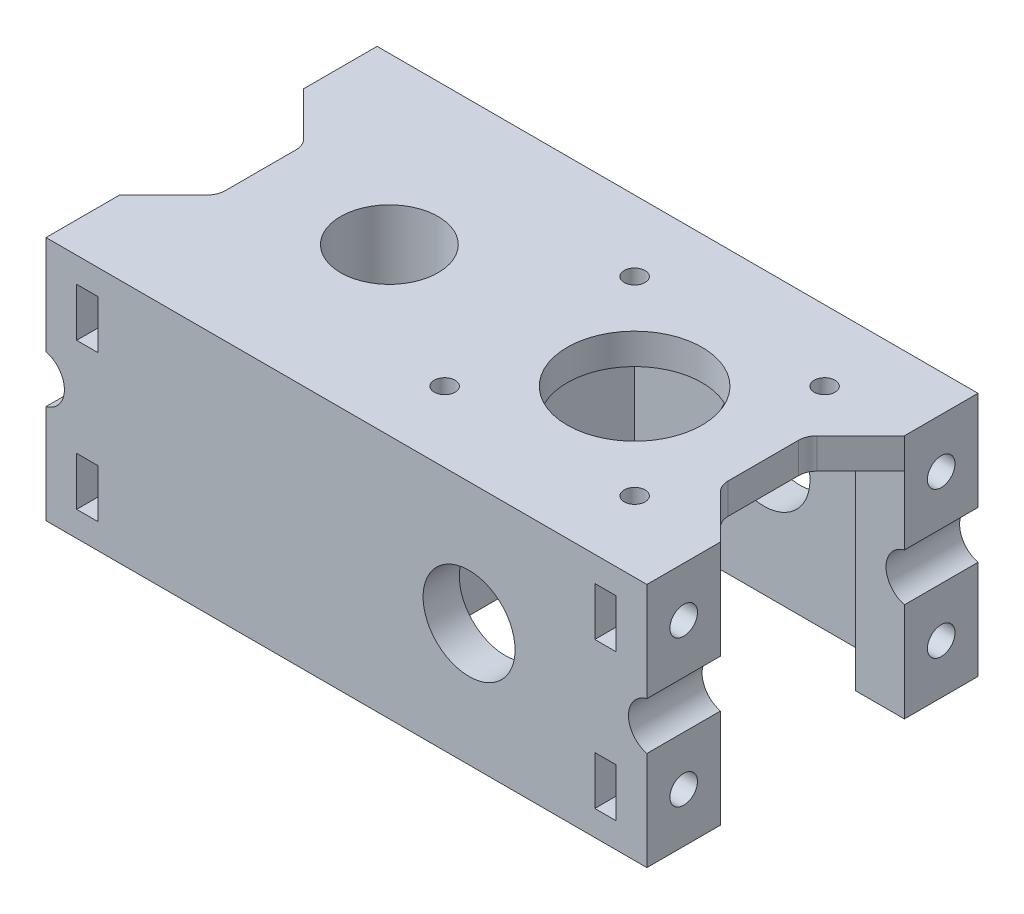
from build123d import *

# Parameters (mm, degrees)
SKETCH3_W                           = 82
SKETCH3_H                           = 54
BOSS_EXTRUDE2_DEPTH                 = 20
MOTOR_START                         = -5
SKETCH6_W                           = 42.2
SKETCH6_H                           = 42.2
MOTOR_POCKET_DEPTH                  = 73.781745931
SKETCH7_R                           = 11
MOTOR_PILOT_HOLE_DEPTH              = 78.781745931
M3_CLEARANCE_HOLE1_MOTOR_MOUNTING_D = 3.4
SKETCH12_R                          = 7.95
CUT_EXTRUDE4_DEPTH                  = 78.781745931
SKETCH14_R                          = 11.1
SLEEVE_BEARING_RECESS_DEPTH         = 3.5
SKETCH15_R                          = 7.5
CUT_EXTRUDE7_DEPTH                  = 84.886828525
BOSS_EXTRUDE8_START                 = 27
BOSS_EXTRUDE8_DEPTH                 = 12
MIRROR6_START                       = 27
MIRROR6_COPY_1_DEPTH                = 12
M4_CLEARANCE_HOLE1_AT_2_COUNT       = 2
M4_CLEARANCE_HOLE1_AT_2_PITCH       = 23.872983346
CLAMP_START                         = -5
CLAMP_NUT_POCKETS_DEPTH             = 3.5
MIRROR8_START                       = -5
MIRROR8_COPY_3_DEPTH                = 3.5
CHAMFER3_SIZE                       = 8
FILLET8_R                           = 3


with BuildPart() as part:
    # Sketch3 → Boss-Extrude2 (new, symmetric)
    with BuildSketch(Plane(origin=(0, 0, 0), x_dir=(1, 0, 0), z_dir=(0, 1, 0))):
        with Locations((-20, 0)):
            Rectangle(SKETCH3_W, SKETCH3_H)
    extrude(amount=BOSS_EXTRUDE2_DEPTH, both=True)

    # Sketch6 → Motor Pocket (cut, through all)
    with BuildSketch(Plane(origin=(0, 20, 0), x_dir=(1, 0, 0), z_dir=(0, 1, 0)).offset(MOTOR_START)):
        Rectangle(SKETCH6_W, SKETCH6_H)
    extrude(amount=-MOTOR_POCKET_DEPTH, mode=Mode.SUBTRACT)

    # Sketch7 → Motor Pilot Hole (cut, through all)
    with BuildSketch(Plane(origin=(0, 20, 0), x_dir=(1, 0, 0), z_dir=(0, 1, 0))):
        with Locations(Location((0, 0, 0), (0, 0, 270))):
            Circle(SKETCH7_R)
    extrude(amount=-MOTOR_PILOT_HOLE_DEPTH, mode=Mode.SUBTRACT)

    # M3 Clearance Hole1 - Motor Mounting (through all)
    with Locations(Plane(origin=(0, 20, 0), x_dir=(-1, 0, 0), z_dir=(0, 1, 0))):
        with Locations((15.490941809, 15.490941809), (-15.490941809, -15.490941809), (15.490941809, -15.490941809), (-15.490941809, 15.490941809)):
            Hole(M3_CLEARANCE_HOLE1_MOTOR_MOUNTING_D / 2)

    # Sketch12 → Cut-Extrude4 (cut, through all)
    with BuildSketch(Plane(origin=(0, 20, 0), x_dir=(1, 0, 0), z_dir=(0, 1, 0))):
        with Locations(Location((-40, 0, 0), (0, 0, 270))):
            Circle(SKETCH12_R)
    extrude(amount=-CUT_EXTRUDE4_DEPTH, mode=Mode.SUBTRACT)

    # Sketch14 → Sleeve Bearing Recess (cut)
    with BuildSketch(Plane.XZ.offset(20)):
        with Locations(Location((-40, 0, 0), (0, 0, 270))):
            Circle(SKETCH14_R)
    extrude(amount=-SLEEVE_BEARING_RECESS_DEPTH, mode=Mode.SUBTRACT)

    # Sketch15 → Cut-Extrude7 (cut, through all)
    with BuildSketch(Plane.XY.offset(27)):
        Circle(SKETCH15_R)
    extrude(amount=-CUT_EXTRUDE7_DEPTH, mode=Mode.SUBTRACT)

    # Sketch16 → Boss-Extrude8 (add)
    with BuildSketch(Plane.XY.offset(BOSS_EXTRUDE8_START)):
        with BuildLine():
            Line((21, 20), (21, -20))
            Line((21, -20), (29, -20))
            Line((29, -20), (29, -3.872983346))
            ThreePointArc((29, -3.872983346), (26, 0), (29, 3.872983346))
            Line((29, 3.872983346), (29, 20))
            Line((29, 20), (21, 20))
        make_face()
    boss_extrude8 = extrude(amount=-BOSS_EXTRUDE8_DEPTH)

    # Mirror5: Boss-Extrude8 across plane
    add(boss_extrude8.mirror(Plane.XY))

    # Mirror6: Boss-Extrude8 across plane
    add(boss_extrude8.mirror(Plane(origin=(-20, 0, 0), x_dir=(0, 0, 1), z_dir=(1, 0, 0))))

    # Mirror6 copy 1 sketch → Mirror6 copy 1 (add)
    with BuildSketch(Plane(origin=(-40, 0, 0), x_dir=(-1, 0, 0), z_dir=(0, 0, -1)).offset(MIRROR6_START)):
        with BuildLine():
            Line((21, 20), (21, -20))
            Line((21, -20), (29, -20))
            Line((29, -20), (29, -3.872983346))
            ThreePointArc((29, -3.872983346), (26, 0), (29, 3.872983346))
            Line((29, 3.872983346), (29, 20))
            Line((29, 20), (21, 20))
        make_face()
    extrude(amount=-MIRROR6_COPY_1_DEPTH)

    # Sketch18 → M4 Clearance Hole1 (revolve, cut)
    with BuildSketch(Plane(origin=(29, 11.936491673, 21), x_dir=(0, 0, -1), z_dir=(0, 1, 0))):
        Polygon((0, 0), (0, 13.351936393), (2.25, 12), (2.25, 0), align=None)
    m4_clearance_hole1 = revolve(axis=Axis((35.35, 11.936491673, 21), (-1, 0, 0)), mode=Mode.SUBTRACT)

    # M4 Clearance Hole1 at 2: M4 Clearance Hole1 ×2
    with Locations(*[(0, -i * M4_CLEARANCE_HOLE1_AT_2_PITCH, 0) for i in range(1, M4_CLEARANCE_HOLE1_AT_2_COUNT)]):
        add(m4_clearance_hole1, mode=Mode.SUBTRACT)

    # Sketch17 → Clamp Nut Pockets (cut)
    with BuildSketch(Plane(origin=(29, 0, 0), x_dir=(0, 0, -1), z_dir=(1, 0, 0)).offset(CLAMP_START)):
        Polygon((-21, -7.981642329), (-27, -7.981642329), (-27, -15.891341017), (-21, -15.891341017), (-17.575, -13.913916345), (-17.575, -9.959067001), align=None)
        Polygon((-21, 7.981642329), (-17.575, 9.959067001), (-17.575, 13.913916345), (-21, 15.891341017), (-27, 15.891341017), (-27, 7.981642329), align=None)
    clamp_nut_pockets = extrude(amount=-CLAMP_NUT_POCKETS_DEPTH, mode=Mode.SUBTRACT)

    # Mirror7: M4 Clearance Hole1, Clamp Nut Pockets across plane
    add(m4_clearance_hole1.mirror(Plane.XY), mode=Mode.SUBTRACT)
    add(clamp_nut_pockets.mirror(Plane.XY), mode=Mode.SUBTRACT)

    # Mirror7 copy 1 sketch → Mirror7 copy 1 (revolve, cut)
    with BuildSketch(Plane(origin=(29, -11.936491673, -21), x_dir=(0, 0, 1), z_dir=(0, 1, 0))):
        Polygon((0, 0), (0, -13.351936393), (2.25, -12), (2.25, 0), align=None)
    revolve(axis=Axis((35.35, -11.936491673, -21), (1, 0, 0)), mode=Mode.SUBTRACT)

    # Mirror8: M4 Clearance Hole1, Clamp Nut Pockets across plane
    add(m4_clearance_hole1.mirror(Plane(origin=(-20, 0, 0), x_dir=(0, 0, 1), z_dir=(1, 0, 0))), mode=Mode.SUBTRACT)
    add(clamp_nut_pockets.mirror(Plane(origin=(-20, 0, 0), x_dir=(0, 0, 1), z_dir=(1, 0, 0))), mode=Mode.SUBTRACT)

    # Mirror8 copy 1 sketch → Mirror8 copy 1 (revolve, cut)
    with BuildSketch(Plane(origin=(-69, -11.936491673, 21), x_dir=(0, 0, -1), z_dir=(0, 1, 0))):
        Polygon((0, 0), (0, -13.351936393), (2.25, -12), (2.25, 0), align=None)
    revolve(axis=Axis((-75.35, -11.936491673, 21), (-1, 0, 0)), mode=Mode.SUBTRACT)

    # Mirror8 copy 2 sketch → Mirror8 copy 2 (revolve, cut)
    with BuildSketch(Plane(origin=(-69, 11.936491673, -21), x_dir=(0, 0, 1), z_dir=(0, 1, 0))):
        Polygon((0, 0), (0, 13.351936393), (2.25, 12), (2.25, 0), align=None)
    revolve(axis=Axis((-75.35, 11.936491673, -21), (1, 0, 0)), mode=Mode.SUBTRACT)

    # Mirror8 copy 3 sketch → Mirror8 copy 3 (cut)
    with BuildSketch(Plane.ZY.offset(69).offset(MIRROR8_START)):
        Polygon((-21, -7.981642329), (-27, -7.981642329), (-27, -15.891341017), (-21, -15.891341017), (-17.575, -13.913916345), (-17.575, -9.959067001), align=None)
        Polygon((-21, 7.981642329), (-17.575, 9.959067001), (-17.575, 13.913916345), (-21, 15.891341017), (-27, 15.891341017), (-27, 7.981642329), align=None)
    extrude(amount=-MIRROR8_COPY_3_DEPTH, mode=Mode.SUBTRACT)

    # Mirror8 copy 4 sketch → Mirror8 copy 4 (revolve, cut)
    with BuildSketch(Plane(origin=(-69, -11.936491673, -21), x_dir=(0, 0, 1), z_dir=(0, 1, 0))):
        Polygon((0, 0), (0, 13.351936393), (2.25, 12), (2.25, 0), align=None)
    revolve(axis=Axis((-75.35, -11.936491673, -21), (1, 0, 0)), mode=Mode.SUBTRACT)

    # Chamfer3
    # the kernel refuses this chamfer: 8 mm, written as the material it adds along each edge
    with BuildSketch(Plane(origin=(-61, 20, -15), x_dir=(-0.9996219169112968, 0, -0.027495876610586296), z_dir=(0, -1, 0))) as chamfer3_piece_1_section:
        Polygon((CHAMFER3_SIZE * 0.999621916911, -CHAMFER3_SIZE * 0.0274958766106), (-CHAMFER3_SIZE * 0.0274958766106, -CHAMFER3_SIZE * 0.999621916911), (0, 0), align=None)
    chamfer3_piece_1 = extrude(amount=40, mode=Mode.PRIVATE)
    chamfer3_piece_1 = chamfer3_piece_1 - Plane(origin=(-70, 0, -12.302715733), x_dir=(0.2500000000000009, -0.968245836551854, 0), z_dir=(0, 0, -1)) * Cylinder(4, 112, mode=Mode.PRIVATE)
    add(chamfer3_piece_1)
    with BuildSketch(Plane(origin=(-61, 20, 15), x_dir=(0.027495876610586487, 0, -0.9996219169112968), z_dir=(0, -1, 0))) as chamfer3_piece_2_section:
        Polygon((CHAMFER3_SIZE * 0.999621916911, -CHAMFER3_SIZE * 0.0274958766106), (-CHAMFER3_SIZE * 0.0274958766106, -CHAMFER3_SIZE * 0.999621916911), (0, 0), align=None)
    chamfer3_piece_2 = extrude(amount=40, mode=Mode.PRIVATE)
    chamfer3_piece_2 = chamfer3_piece_2 - Plane(origin=(-70, 0, 12.302715733), x_dir=(0.2500000000000009, -0.968245836551854, 0), z_dir=(0, 0, 1)) * Cylinder(4, 112, mode=Mode.PRIVATE)
    add(chamfer3_piece_2)
    with BuildSketch(Plane(origin=(21, 20, 15), x_dir=(0.9996219169112968, 0, 0.02749587661058627), z_dir=(0, -1, 0))) as chamfer3_piece_3:
        Polygon((CHAMFER3_SIZE * 0.999621916911, -CHAMFER3_SIZE * 0.0274958766106), (-CHAMFER3_SIZE * 0.0274958766106, -CHAMFER3_SIZE * 0.999621916911), (0, 0), align=None)
    extrude(amount=5)
    with BuildSketch(Plane(origin=(21, 20, -15), x_dir=(0.9996219169112968, 0, -0.02749587661058627), z_dir=(0, -1, 0))) as chamfer3_piece_4:
        Polygon((CHAMFER3_SIZE * 0.999621916911, CHAMFER3_SIZE * 0.0274958766106), (-CHAMFER3_SIZE * 0.0274958766106, CHAMFER3_SIZE * 0.999621916911), (0, 0), align=None)
    extrude(amount=5)

    # Fillet8
    fillet8_edges = [part.edges().sort_by_distance(p)[0] for p in [
        (-61, 0, -7),
        (-61, 0, 7),
        (21, 17.5, 7),
        (21, 17.5, -7),
    ]]
    fillet(fillet8_edges, radius=FILLET8_R)


solid = part.part
